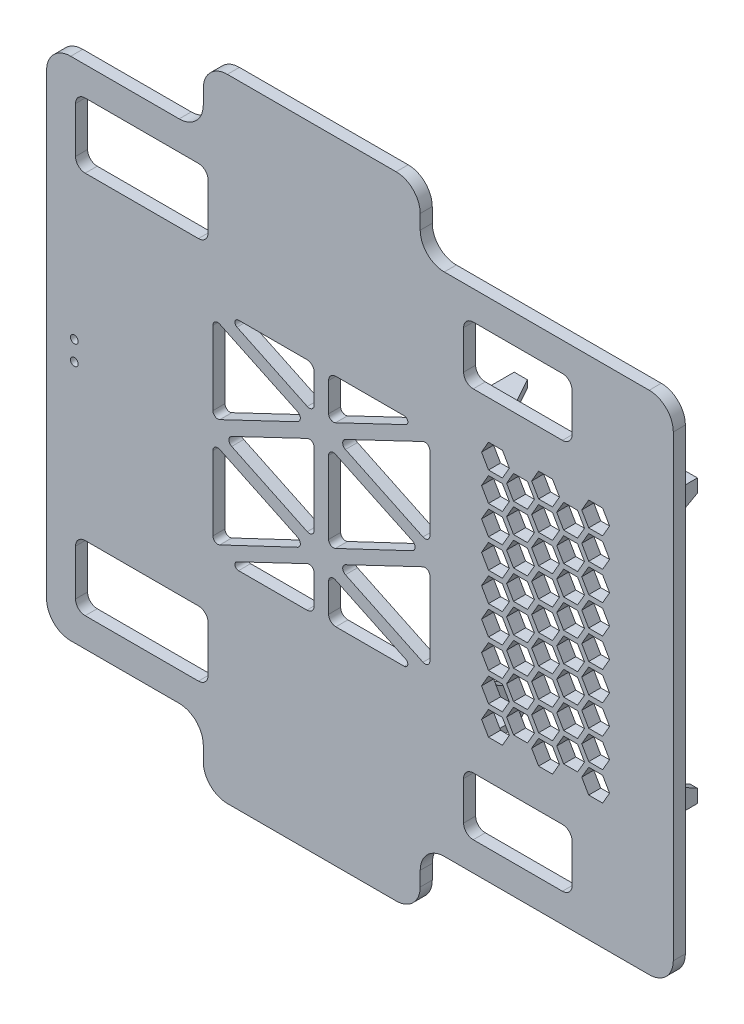
from build123d import *

# Parameters (mm, degrees)
EXTRUDE_1_DEPTH          = 5
EXTRUDE_2_DEPTH          = 20
CUT_EXTRUDE_3_DEPTH      = 10
CUT_EXTRUDE_4_DEPTH      = 10
MIRROR_2_COPY_1_DEPTH    = 20
MIRROR_2_COPY_2_DEPTH    = 10
MIRROR_2_COPY_3_DEPTH    = 10
MIRROR_2_COPY_4_DEPTH    = 20
MIRROR_2_COPY_5_DEPTH    = 10
MIRROR_2_COPY_6_DEPTH    = 10
CUT_EXTRUDE_5_DEPTH      = 5
SKETCH_9_W               = 55
SKETCH_9_H               = 27
SKETCH_9_W_2             = 45
SKETCH_9_H_2             = 24
CUT_EXTRUDE_6_DEPTH      = 5
FILLET_1_R               = 4
FILLET_2_R               = 1.5
FILLET_3_R               = 2
FILLET_4_R               = 3
CUT_EXTRUDE_7_DEPTH      = 3
CUT_EXTRUDE_7_DEPTH_BACK = 8
SKETCH_10_R              = 1.6


with BuildPart() as part:
    # 草图1 → 凸台-拉伸1 (new body)
    with BuildSketch(Plane.XY):
        with BuildLine():
            Line((-130, 95), (-130, -95))
            ThreePointArc((-130, -95), (-127.071067812, -102.071067812), (-120, -105))
            Line((-120, -105), (-75, -105))
            ThreePointArc((-75, -105), (-67.928932188, -107.928932188), (-65, -115))
            Line((-65, -115), (-65, -121))
            ThreePointArc((-65, -121), (-62.071067812, -128.071067812), (-55, -131))
            Line((-55, -131), (15, -131))
            ThreePointArc((15, -131), (22.071067812, -128.071067812), (25, -121))
            Line((25, -121), (25, -115))
            ThreePointArc((25, -115), (27.928932188, -107.928932188), (35, -105))
            Line((35, -105), (120, -105))
            ThreePointArc((120, -105), (127.071067812, -102.071067812), (130, -95))
            Line((130, -95), (130, 95))
            ThreePointArc((130, 95), (127.071067812, 102.071067812), (120, 105))
            Line((120, 105), (35, 105))
            ThreePointArc((35, 105), (27.928932188, 107.928932188), (25, 115))
            Line((25, 115), (25, 121))
            ThreePointArc((25, 121), (22.071067812, 128.071067812), (15, 131))
            Line((15, 131), (-55, 131))
            ThreePointArc((-55, 131), (-62.071067812, 128.071067812), (-65, 121))
            Line((-65, 121), (-65, 115))
            ThreePointArc((-65, 115), (-67.928932188, 107.928932188), (-75, 105))
            Line((-75, 105), (-120, 105))
            ThreePointArc((-120, 105), (-127.071067812, 102.071067812), (-130, 95))
        make_face()
    extrude(amount=EXTRUDE_1_DEPTH)

    # 草图4 → 凸台-拉伸2 (add)
    with BuildSketch(Plane(origin=(0, 0, 0), x_dir=(-1, 0, 0), z_dir=(0, 0, -1))):
        Polygon((-39, -47.5), (-39, -58.5), (-50, -58.5), (-50, -55.5), (-42, -55.5), (-42, -47.5), align=None)
    extrude_2 = extrude(amount=EXTRUDE_2_DEPTH)

    # 草图5 → 切除-拉伸3 (cut)
    with BuildSketch(Plane.XZ.offset(58.5)):
        Polygon((50, -10), (44.5, -20), (50, -20), align=None)
    cut_extrude_3 = extrude(amount=-CUT_EXTRUDE_3_DEPTH, mode=Mode.SUBTRACT)

    # 草图6 → 切除-拉伸4 (cut)
    with BuildSketch(Plane.ZY.offset(-39)):
        Polygon((-20, -53), (-10, -47.5), (-20, -47.5), align=None)
    cut_extrude_4 = extrude(amount=-CUT_EXTRUDE_4_DEPTH, mode=Mode.SUBTRACT)

    # 镜向1: 凸台-拉伸2, 切除-拉伸3, 切除-拉伸4 across plane
    add(extrude_2.mirror(Plane(origin=(77, 0, 0), x_dir=(0, 0, 1), z_dir=(1, 0, 0))))
    add(cut_extrude_3.mirror(Plane(origin=(77, 0, 0), x_dir=(0, 0, 1), z_dir=(1, 0, 0))), mode=Mode.SUBTRACT)
    add(cut_extrude_4.mirror(Plane(origin=(77, 0, 0), x_dir=(0, 0, 1), z_dir=(1, 0, 0))), mode=Mode.SUBTRACT)

    # 镜向2 copy 1 sketch → 镜向2 copy 1 (add)
    with BuildSketch(Plane(origin=(154, 0, 0), x_dir=(1, 0, 0), z_dir=(0, 0, -1))):
        Polygon((-39, -47.5), (-39, -58.5), (-50, -58.5), (-50, -55.5), (-42, -55.5), (-42, -47.5), align=None)
    extrude(amount=MIRROR_2_COPY_1_DEPTH)

    # 镜向2 copy 2 sketch → 镜向2 copy 2 (cut)
    with BuildSketch(Plane(origin=(154, 58.5, 0), x_dir=(-1, 0, 0), z_dir=(0, 1, 0))):
        Polygon((50, -10), (44.5, -20), (50, -20), align=None)
    extrude(amount=-MIRROR_2_COPY_2_DEPTH, mode=Mode.SUBTRACT)

    # 镜向2 copy 3 sketch → 镜向2 copy 3 (cut)
    with BuildSketch(Plane(origin=(115, 0, 0), x_dir=(0, 0, 1), z_dir=(1, 0, 0))):
        Polygon((-20, -53), (-10, -47.5), (-20, -47.5), align=None)
    extrude(amount=-MIRROR_2_COPY_3_DEPTH, mode=Mode.SUBTRACT)

    # 镜向2 copy 4 sketch → 镜向2 copy 4 (add)
    with BuildSketch(Plane(origin=(0, 0, 0), x_dir=(-1, 0, 0), z_dir=(0, 0, -1))):
        Polygon((-39, 47.5), (-39, 58.5), (-50, 58.5), (-50, 55.5), (-42, 55.5), (-42, 47.5), align=None)
    extrude(amount=MIRROR_2_COPY_4_DEPTH)

    # 镜向2 copy 5 sketch → 镜向2 copy 5 (cut)
    with BuildSketch(Plane(origin=(0, 58.5, 0), x_dir=(1, 0, 0), z_dir=(0, 1, 0))):
        Polygon((50, 10), (44.5, 20), (50, 20), align=None)
    extrude(amount=-MIRROR_2_COPY_5_DEPTH, mode=Mode.SUBTRACT)

    # 镜向2 copy 6 sketch → 镜向2 copy 6 (cut)
    with BuildSketch(Plane.ZY.offset(-39)):
        Polygon((-20, 53), (-10, 47.5), (-20, 47.5), align=None)
    extrude(amount=-MIRROR_2_COPY_6_DEPTH, mode=Mode.SUBTRACT)

    # 草图7 → 切除-拉伸5 (cut)
    with BuildSketch(Plane(origin=(0, 0, 0), x_dir=(-1, 0, 0), z_dir=(0, 0, -1))):
        Polygon((-92.012994616, 36), (-94.899745962, 41), (-100.673248654, 41), (-103.56, 36), (-100.673248654, 31), (-94.899745962, 31), align=None)
        Polygon((-74.115136271, 31), (-71.228384925, 36), (-74.115136271, 41), (-79.888638963, 41), (-82.775390309, 36), (-79.888638963, 31), align=None)
        Polygon((-92.012994616, 24), (-94.899745962, 29), (-100.673248654, 29), (-103.56, 24), (-100.673248654, 19), (-94.899745962, 19), align=None)
        Polygon((-93.167695155, 30), (-90.280943809, 25), (-84.507441117, 25), (-81.620689771, 30), (-84.507441117, 35), (-90.280943809, 35), align=None)
        Polygon((-84.507441117, 37), (-81.620689771, 42), (-84.507441117, 47), (-90.280943809, 47), (-93.167695155, 42), (-90.280943809, 37), align=None)
        Polygon((-79.888638963, 43), (-74.115136271, 43), (-71.228384925, 48), (-74.115136271, 53), (-79.888638963, 53), (-82.775390309, 48), align=None)
        Polygon((-94.899745962, 43), (-92.012994616, 48), (-94.899745962, 53), (-100.673248654, 53), (-103.56, 48), (-100.673248654, 43), align=None)
        Polygon((-72.383085464, 42), (-69.496334118, 37), (-63.722831426, 37), (-60.83608008, 42), (-63.722831426, 47), (-69.496334118, 47), align=None)
        Polygon((-93.167695155, 18), (-90.280943809, 13), (-84.507441117, 13), (-81.620689771, 18), (-84.507441117, 23), (-90.280943809, 23), align=None)
        Polygon((-74.115136271, 19), (-71.228384925, 24), (-74.115136271, 29), (-79.888638963, 29), (-82.775390309, 24), (-79.888638963, 19), align=None)
        Polygon((-72.383085464, 30), (-69.496334118, 25), (-63.722831426, 25), (-60.83608008, 30), (-63.722831426, 35), (-69.496334118, 35), align=None)
        Polygon((-92.012994616, 12), (-94.899745962, 17), (-100.673248654, 17), (-103.56, 12), (-100.673248654, 7), (-94.899745962, 7), align=None)
        Polygon((-93.167695155, 6), (-90.280943809, 1), (-84.507441117, 1), (-81.620689771, 6), (-84.507441117, 11), (-90.280943809, 11), align=None)
        Polygon((-74.115136271, 7), (-71.228384925, 12), (-74.115136271, 17), (-79.888638963, 17), (-82.775390309, 12), (-79.888638963, 7), align=None)
        Polygon((-72.383085464, 18), (-69.496334118, 13), (-63.722831426, 13), (-60.83608008, 18), (-63.722831426, 23), (-69.496334118, 23), align=None)
        Polygon((-92.012994616, 0), (-94.899745962, 5), (-100.673248654, 5), (-103.56, 0), (-100.673248654, -5), (-94.899745962, -5), align=None)
        Polygon((-93.167695155, -6), (-90.280943809, -11), (-84.507441117, -11), (-81.620689771, -6), (-84.507441117, -1), (-90.280943809, -1), align=None)
        Polygon((-74.115136271, -5), (-71.228384925, 0), (-74.115136271, 5), (-79.888638963, 5), (-82.775390309, 0), (-79.888638963, -5), align=None)
        Polygon((-72.383085464, 6), (-69.496334118, 1), (-63.722831426, 1), (-60.83608008, 6), (-63.722831426, 11), (-69.496334118, 11), align=None)
        Polygon((-92.012994616, -12), (-94.899745962, -7), (-100.673248654, -7), (-103.56, -12), (-100.673248654, -17), (-94.899745962, -17), align=None)
        Polygon((-93.167695155, -18), (-90.280943809, -23), (-84.507441117, -23), (-81.620689771, -18), (-84.507441117, -13), (-90.280943809, -13), align=None)
        Polygon((-74.115136271, -17), (-71.228384925, -12), (-74.115136271, -7), (-79.888638963, -7), (-82.775390309, -12), (-79.888638963, -17), align=None)
        Polygon((-72.383085464, -6), (-69.496334118, -11), (-63.722831426, -11), (-60.83608008, -6), (-63.722831426, -1), (-69.496334118, -1), align=None)
        Polygon((-92.012994616, -24), (-94.899745962, -19), (-100.673248654, -19), (-103.56, -24), (-100.673248654, -29), (-94.899745962, -29), align=None)
        Polygon((-93.167695155, -30), (-90.280943809, -35), (-84.507441117, -35), (-81.620689771, -30), (-84.507441117, -25), (-90.280943809, -25), align=None)
        Polygon((-74.115136271, -29), (-71.228384925, -24), (-74.115136271, -19), (-79.888638963, -19), (-82.775390309, -24), (-79.888638963, -29), align=None)
        Polygon((-72.383085464, -18), (-69.496334118, -23), (-63.722831426, -23), (-60.83608008, -18), (-63.722831426, -13), (-69.496334118, -13), align=None)
        Polygon((-92.012994616, -36), (-94.899745962, -31), (-100.673248654, -31), (-103.56, -36), (-100.673248654, -41), (-94.899745962, -41), align=None)
        Polygon((-93.167695155, -42), (-90.280943809, -47), (-84.507441117, -47), (-81.620689771, -42), (-84.507441117, -37), (-90.280943809, -37), align=None)
        Polygon((-74.115136271, -41), (-71.228384925, -36), (-74.115136271, -31), (-79.888638963, -31), (-82.775390309, -36), (-79.888638963, -41), align=None)
        Polygon((-72.383085464, -30), (-69.496334118, -35), (-63.722831426, -35), (-60.83608008, -30), (-63.722831426, -25), (-69.496334118, -25), align=None)
        Polygon((-92.012994616, -48), (-94.899745962, -43), (-100.673248654, -43), (-103.56, -48), (-100.673248654, -53), (-94.899745962, -53), align=None)
        Polygon((-74.115136271, -53), (-71.228384925, -48), (-74.115136271, -43), (-79.888638963, -43), (-82.775390309, -48), (-79.888638963, -53), align=None)
        Polygon((-72.383085464, -42), (-69.496334118, -47), (-63.722831426, -47), (-60.83608008, -42), (-63.722831426, -37), (-69.496334118, -37), align=None)
        Polygon((-61.990780618, 36), (-59.104029272, 31), (-53.330526581, 31), (-50.443775235, 36), (-53.330526581, 41), (-59.104029272, 41), align=None)
        Polygon((-61.990780618, 48), (-59.104029272, 43), (-53.330526581, 43), (-50.443775235, 48), (-53.330526581, 53), (-59.104029272, 53), align=None)
        Polygon((-61.990780618, 24), (-59.104029272, 19), (-53.330526581, 19), (-50.443775235, 24), (-53.330526581, 29), (-59.104029272, 29), align=None)
        Polygon((-61.990780618, 12), (-59.104029272, 7), (-53.330526581, 7), (-50.443775235, 12), (-53.330526581, 17), (-59.104029272, 17), align=None)
        Polygon((-61.990780618, 0), (-59.104029272, -5), (-53.330526581, -5), (-50.443775235, 0), (-53.330526581, 5), (-59.104029272, 5), align=None)
        Polygon((-61.990780618, -12), (-59.104029272, -17), (-53.330526581, -17), (-50.443775235, -12), (-53.330526581, -7), (-59.104029272, -7), align=None)
        Polygon((-61.990780618, -24), (-59.104029272, -29), (-53.330526581, -29), (-50.443775235, -24), (-53.330526581, -19), (-59.104029272, -19), align=None)
        Polygon((-61.990780618, -36), (-59.104029272, -41), (-53.330526581, -41), (-50.443775235, -36), (-53.330526581, -31), (-59.104029272, -31), align=None)
        Polygon((-61.990780618, -48), (-59.104029272, -53), (-53.330526581, -53), (-50.443775235, -48), (-53.330526581, -43), (-59.104029272, -43), align=None)
    extrude(amount=-CUT_EXTRUDE_5_DEPTH, mode=Mode.SUBTRACT)

    # 草图9 → 切除-拉伸6 (cut)
    with BuildSketch(Plane(origin=(0, 0, 0), x_dir=(-1, 0, 0), z_dir=(0, 0, -1))):
        Polygon((9.804878049, 22.5), (-29, 41), (-29, 4), align=None)
        Polygon((13, -26.88372093), (-25, -45), (13, -45), align=None)
        Polygon((22.074593576, -22.557461202), (61, -41), (61, -4), align=None)
        Polygon((19, 26.88372093), (57, 45), (19, 45), align=None)
        Polygon((19, -18.11627907), (57, 0), (19, 18.11627907), align=None)
        with Locations((90.5, 79.5)):
            Rectangle(SKETCH_9_W, SKETCH_9_H)
        with Locations((90.5, -79.5)):
            Rectangle(SKETCH_9_W, SKETCH_9_H)
        with Locations((-65.5, 81)):
            Rectangle(SKETCH_9_W_2, SKETCH_9_H_2)
        with Locations((-65.5, -81)):
            Rectangle(SKETCH_9_W_2, SKETCH_9_H_2)
        Polygon((13, 45), (-25, 45), (13, 26.88372093), align=None)
        Polygon((61, 4), (61, 41), (22.074593576, 22.557461202), align=None)
        Polygon((13, 18.257993079), (-25.535898385, 0), (13, -18.257993079), align=None)
        Polygon((19, -45), (57, -45), (19, -26.88372093), align=None)
        Polygon((-29, -41), (9.804878049, -22.5), (-29, -4), align=None)
    extrude(amount=-CUT_EXTRUDE_6_DEPTH, mode=Mode.SUBTRACT)

    # 圆角1
    fillet_1_edges = [part.edges().sort_by_distance(p)[0] for p in [
        (-63, -93, 2.5),
        (-63, -66, 2.5),
        (-118, -93, 2.5),
        (-118, -66, 2.5),
        (-63, 66, 2.5),
        (-118, 66, 2.5),
        (-118, 93, 2.5),
        (-63, 93, 2.5),
        (43, -93, 2.5),
        (88, -69, 2.5),
        (43, -69, 2.5),
        (88, -93, 2.5),
        (88, 69, 2.5),
        (43, 69, 2.5),
        (43, 93, 2.5),
        (88, 93, 2.5),
    ]]
    fillet(fillet_1_edges, radius=FILLET_1_R)

    # 圆角2
    fillet_2_edges = [part.edges().sort_by_distance(p)[0] for p in [
        (25, -45, 2.5),
        (-57, -45, 2.5),
        (25, 45, 2.5),
        (-57, 45, 2.5),
    ]]
    fillet(fillet_2_edges, radius=FILLET_2_R)

    # 圆角3
    fillet_3_edges = [part.edges().sort_by_distance(p)[0] for p in [
        (29, -4, 2.5),
        (29, 4, 2.5),
        (-13, -18.257993079, 2.5),
        (-61, -41, 2.5),
        (-61, 4, 2.5),
        (-13, -26.88372093, 2.5),
        (-13, 18.257993079, 2.5),
        (-61, -4, 2.5),
        (-22.074593576, -22.557461202, 2.5),
        (25.535898385, 0, 2.5),
        (-22.074593576, 22.557461202, 2.5),
        (-61, 41, 2.5),
        (-19, 26.88372093, 2.5),
        (-19, -26.88372093, 2.5),
        (-19, -18.11627907, 2.5),
        (29, -41, 2.5),
        (29, 41, 2.5),
        (-57, 0, 2.5),
        (-9.804878049, -22.5, 2.5),
        (-13, 26.88372093, 2.5),
        (-9.804878049, 22.5, 2.5),
        (-19, 18.11627907, 2.5),
    ]]
    fillet(fillet_3_edges, radius=FILLET_3_R)

    # 圆角4
    fillet_4_edges = [part.edges().sort_by_distance(p)[0] for p in [
        (-13, -45, 2.5),
        (-13, 45, 2.5),
        (-19, -45, 2.5),
        (-19, 45, 2.5),
    ]]
    fillet(fillet_4_edges, radius=FILLET_4_R)

    # 草图10 → 切除-拉伸7 (cut, two sides: drawn at the far end of the back side and taken through both)
    with BuildSketch(Plane.XY.offset(5).offset(-CUT_EXTRUDE_7_DEPTH_BACK)):
        with Locations((-118.5, -4.05)):
            Circle(SKETCH_10_R)
        with Locations((-118.5, 4.05)):
            Circle(SKETCH_10_R)
    extrude(amount=CUT_EXTRUDE_7_DEPTH + CUT_EXTRUDE_7_DEPTH_BACK, mode=Mode.SUBTRACT)


solid = part.part
